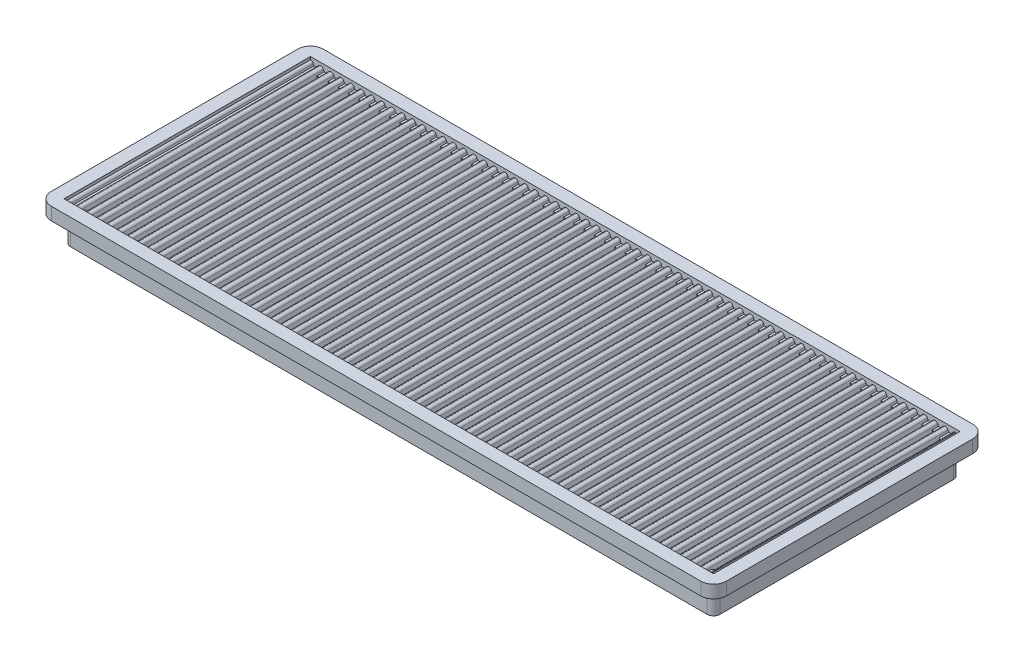
from build123d import *

# Parameters (mm, degrees)
SKETCH1_W                = 322.2752
SKETCH1_H                = 122.2502
BOSS_EXTRUDE1_DEPTH      = 6.35
EXTRUDE_THIN1_DEPTH      = 122.2502
LPATTERN3_COUNT          = 63
LPATTERN3_PITCH          = 5.08
BOSS_EXTRUDE2_DEPTH      = 12.7
BOSS_EXTRUDE2_DEPTH_BACK = 3.175
SKETCH3_W                = 322.2752
SKETCH3_H                = 122.2502
FILLET1_R                = 3.175


with BuildPart() as part:
    # Sketch1 → Boss-Extrude1 (new body)
    with BuildSketch(Plane(origin=(0, 0, 0), x_dir=(1, 0, 0), z_dir=(0, 1, 0))):
        with BuildLine():
            Line((6.35, 0), (328.6252, 0))
            ThreePointArc((328.6252, 0), (333.115328061, 1.859871939), (334.9752, 6.35))
            Line((334.9752, 6.35), (334.9752, 128.6002))
            ThreePointArc((334.9752, 128.6002), (333.115328061, 133.090328061), (328.6252, 134.9502))
            Line((328.6252, 134.9502), (6.35, 134.9502))
            ThreePointArc((6.35, 134.9502), (1.859871939, 133.090328061), (0, 128.6002))
            Line((0, 128.6002), (0, 6.35))
            ThreePointArc((0, 6.35), (1.859871939, 1.859871939), (6.35, 0))
        make_face()
        with Locations((167.4876, 67.4751)):
            Rectangle(SKETCH1_W, SKETCH1_H, mode=Mode.SUBTRACT)
    extrude(amount=BOSS_EXTRUDE1_DEPTH)

    # Sketch2 → Extrude-Thin1 (add)
    with BuildSketch(Plane.XY.offset(-128.6002)):
        with BuildLine():
            ThreePointArc((6.35, 4.926986509), (7.198248843, 4.662291697), (7.745424002, 3.962156862))
            ThreePointArc((7.745424002, 3.962156862), (8.119606585, 3.040070338), (8.53867389, 2.13749693))
            ThreePointArc((8.53867389, 2.13749693), (8.984332802, 1.862533907), (9.426719448, 2.142731311))
            ThreePointArc((9.426719448, 2.142731311), (9.814754664, 3.038749471), (10.132148205, 3.962156862))
            ThreePointArc((10.132148205, 3.962156862), (10.62140314, 4.659354934), (11.43, 4.926986509))
            Line((11.43, 4.926986509), (11.43, 3.656986509))
            ThreePointArc((11.43, 3.656986509), (11.379094465, 3.640137658), (11.348293226, 3.596245277))
            ThreePointArc((11.348293226, 3.596245277), (10.998867298, 2.579644615), (10.57167031, 1.593197395))
            ThreePointArc((10.57167031, 1.593197395), (8.991818396, 0.592555968), (7.400280561, 1.574504366))
            ThreePointArc((7.400280561, 1.574504366), (6.954908822, 2.533731401), (6.557239173, 3.513696371))
            ThreePointArc((6.557239173, 3.513696371), (6.475976326, 3.617675781), (6.35, 3.656986509))
            Line((6.35, 3.656986509), (6.35, 4.926986509))
        make_face()
    extrude_thin1 = extrude(amount=EXTRUDE_THIN1_DEPTH)

    # LPattern3: Extrude-Thin1 ×63
    with Locations(*[(i * LPATTERN3_PITCH, 0, 0) for i in range(1, LPATTERN3_COUNT)]):
        add(extrude_thin1)

    # Sketch3 → Boss-Extrude2 (add, two sides: drawn at the far end of the back side and taken through both)
    with BuildSketch(Plane.XZ.offset(-BOSS_EXTRUDE2_DEPTH_BACK)):
        with Locations((167.4876, -67.4751)):
            Rectangle(SKETCH3_W, SKETCH3_H)
        with BuildLine():
            ThreePointArc((15.875, -9.525), (11.384871939, -11.384871939), (9.525, -15.875))
            Line((9.525, -15.875), (9.525, -119.0752))
            ThreePointArc((9.525, -119.0752), (11.384871939, -123.565328061), (15.875, -125.4252))
            Line((15.875, -125.4252), (319.1002, -125.4252))
            ThreePointArc((319.1002, -125.4252), (323.590328061, -123.565328061), (325.4502, -119.0752))
            Line((325.4502, -119.0752), (325.4502, -15.875))
            ThreePointArc((325.4502, -15.875), (323.590328061, -11.384871939), (319.1002, -9.525))
            Line((319.1002, -9.525), (15.875, -9.525))
        make_face(mode=Mode.SUBTRACT)
    extrude(amount=BOSS_EXTRUDE2_DEPTH + BOSS_EXTRUDE2_DEPTH_BACK)

    # Fillet1
    fillet1_edges = [part.edges().sort_by_distance(p)[0] for p in [
        (6.35, 0, -67.4751),
        (167.4876, 0, -6.35),
        (328.6252, 0, -67.4751),
        (167.4876, 0, -128.6002),
        (328.6252, -6.35, -128.6002),
        (6.35, -6.35, -6.35),
        (6.35, -6.35, -128.6002),
        (328.6252, -6.35, -6.35),
    ]]
    fillet(fillet1_edges, radius=FILLET1_R)


solid = part.part
